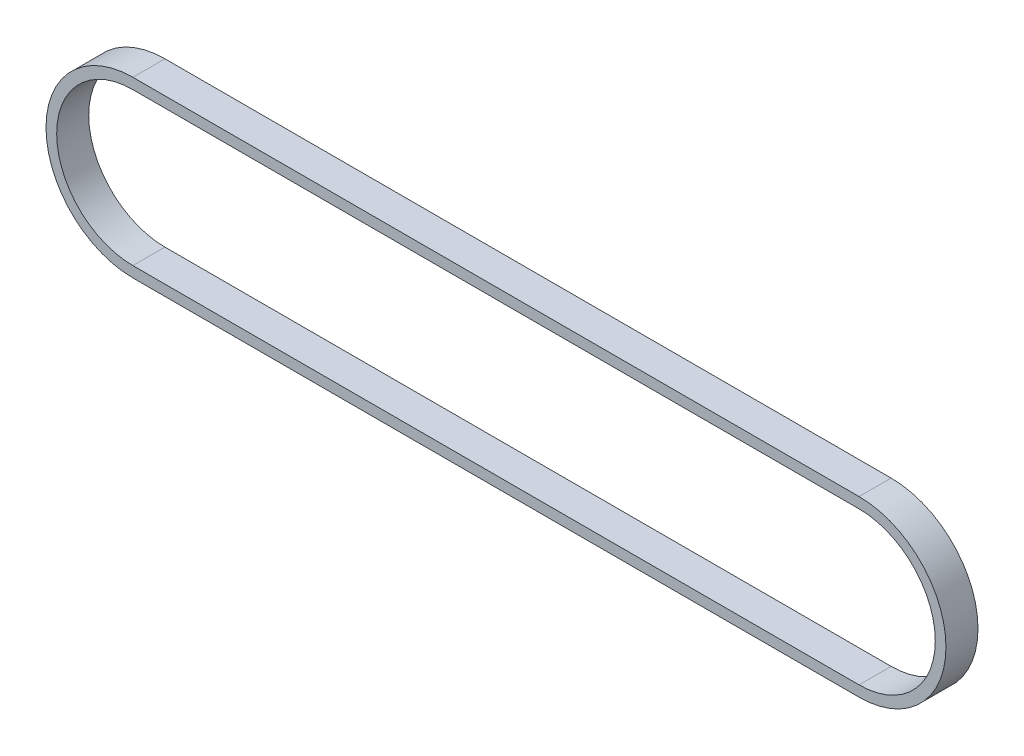
from build123d import *

# Parameters (mm, degrees)
RESSALTO_EXTRUS_O1_DEPTH = 4.5


with BuildPart() as part:
    # Esboço1 → Ressalto-extrusão1 (new, symmetric)
    with BuildSketch(Plane.XY):
        with BuildLine():
            ThreePointArc((0, 24.4), (-24.4, 0), (0, -24.4))
            Line((0, -24.4), (203.94484, -24.4))
            ThreePointArc((203.94484, -24.4), (228.34484, 0), (203.94484, 24.4))
            Line((203.94484, 24.4), (0, 24.4))
        make_face()
        with BuildLine():
            ThreePointArc((0, -21.4), (-21.4, 0), (0, 21.4))
            Line((0, 21.4), (203.94484, 21.4))
            ThreePointArc((203.94484, 21.4), (225.34484, 0), (203.94484, -21.4))
            Line((203.94484, -21.4), (0, -21.4))
        make_face(mode=Mode.SUBTRACT)
    extrude(amount=RESSALTO_EXTRUS_O1_DEPTH, both=True)


solid = part.part
